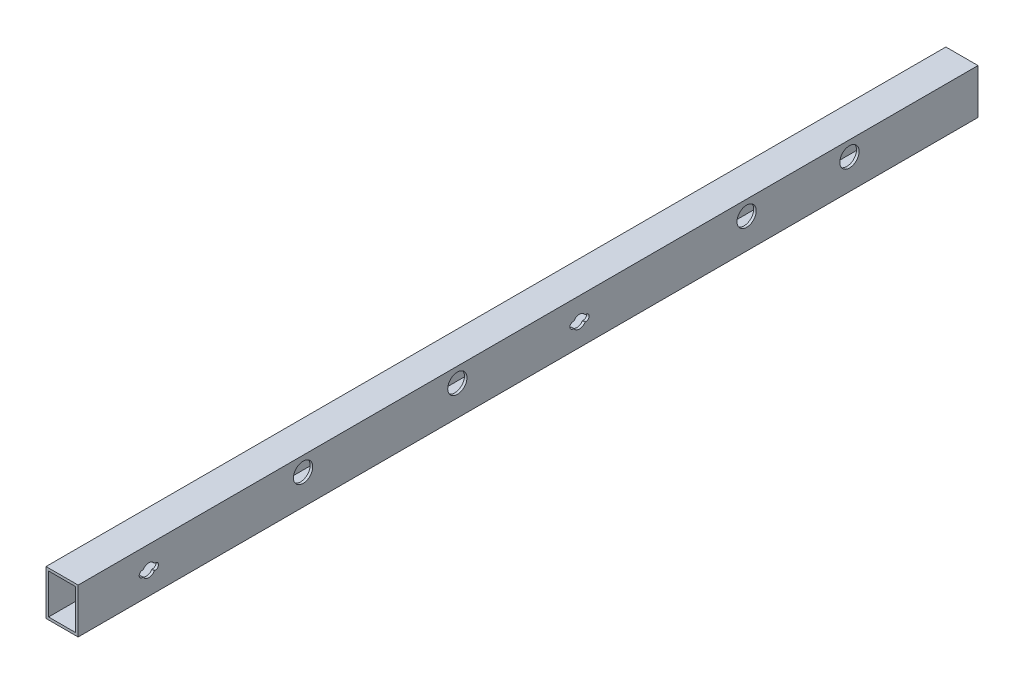
from build123d import *

# Parameters (mm, degrees)
SKETCH1_W           = 50
SKETCH1_H           = 70
SKETCH1_W_2         = 42
SKETCH1_H_2         = 62
BOSS_EXTRUDE2_DEPTH = 1400
SKETCH2_R           = 15
CUT_EXTRUDE1_DEPTH  = 1403.640367307


with BuildPart() as part:
    # Sketch1 → Boss-Extrude2 (new body)
    with BuildSketch(Plane.XY):
        with Locations((25, -35)):
            Rectangle(SKETCH1_W, SKETCH1_H)
        with Locations((25, -35)):
            Rectangle(SKETCH1_W_2, SKETCH1_H_2, mode=Mode.SUBTRACT)
    extrude(amount=BOSS_EXTRUDE2_DEPTH)

    # Sketch2 → Cut-Extrude1 (cut, through all)
    with BuildSketch(Plane(origin=(50, 0, 0), x_dir=(0, 0, -1), z_dir=(1, 0, 0))):
        with Locations((-1050, -23)):
            Circle(SKETCH2_R)
        with Locations((-200, -23)):
            Circle(SKETCH2_R)
        with Locations((-810, -23)):
            Circle(SKETCH2_R)
        with Locations((-360, -23)):
            Circle(SKETCH2_R)
        with BuildLine():
            Line((-1281.339745962, -30), (-1280, -30))
            ThreePointArc((-1280, -30), (-1275, -35), (-1280, -40))
            Line((-1280, -40), (-1281.339745962, -40))
            ThreePointArc((-1281.339745962, -40), (-1290, -45), (-1298.660254038, -40))
            Line((-1298.660254038, -40), (-1300, -40))
            ThreePointArc((-1300, -40), (-1305, -35), (-1300, -30))
            Line((-1300, -30), (-1298.660254038, -30))
            ThreePointArc((-1298.660254038, -30), (-1290, -25), (-1281.339745962, -30))
        make_face()
        with BuildLine():
            Line((-611.339745962, -30), (-610, -30))
            ThreePointArc((-610, -30), (-605, -35), (-610, -40))
            Line((-610, -40), (-611.339745962, -40))
            ThreePointArc((-611.339745962, -40), (-620, -45), (-628.660254038, -40))
            Line((-628.660254038, -40), (-630, -40))
            ThreePointArc((-630, -40), (-635, -35), (-630, -30))
            Line((-630, -30), (-628.660254038, -30))
            ThreePointArc((-628.660254038, -30), (-620, -25), (-611.339745962, -30))
        make_face()
    extrude(amount=-CUT_EXTRUDE1_DEPTH, mode=Mode.SUBTRACT)


solid = part.part
